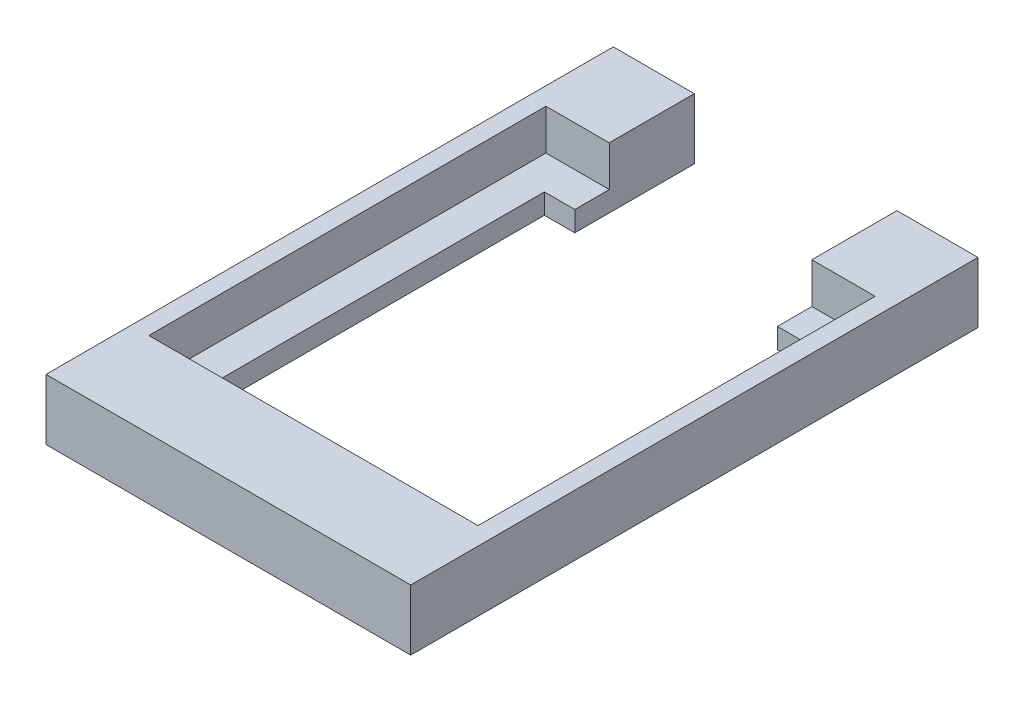
from build123d import *

# Parameters (mm, degrees)
SKETCH1_W           = 18
SKETCH1_H           = 28
BOSS_EXTRUDE1_DEPTH = 3
SKETCH1_3_W         = 13
SKETCH1_3_H         = 16.2
CUT_EXTRUDE1_DEPTH  = 17.911534525
SKETCH2_W           = 16.25
SKETCH2_H           = 19.6
CUT_EXTRUDE2_DEPTH  = 2
SKETCH4_W           = 10
SKETCH4_H           = 9
CUT_EXTRUDE3_DEPTH  = 17.911534525


with BuildPart() as part:
    # Sketch1 → Boss-Extrude1 (new body)
    with BuildSketch(Plane(origin=(0, 0, 0), x_dir=(1, 0, 0), z_dir=(0, 1, 0))):
        Rectangle(SKETCH1_W, SKETCH1_H)
    extrude(amount=BOSS_EXTRUDE1_DEPTH)

    # Sketch1<3> → Cut-Extrude1 (cut, through all)
    with BuildSketch(Plane(origin=(0, 0, 0), x_dir=(1, 0, 0), z_dir=(0, 1, 0))):
        Rectangle(SKETCH1_3_W, SKETCH1_3_H)
    extrude(amount=CUT_EXTRUDE1_DEPTH, mode=Mode.SUBTRACT)

    # Sketch2 → Cut-Extrude2 (cut)
    with BuildSketch(Plane(origin=(0, 3, 0), x_dir=(1, 0, 0), z_dir=(0, 1, 0))):
        Rectangle(SKETCH2_W, SKETCH2_H)
    extrude(amount=-CUT_EXTRUDE2_DEPTH, mode=Mode.SUBTRACT)

    # Sketch4 → Cut-Extrude3 (cut, through all)
    with BuildSketch(Plane(origin=(0, 3, 0), x_dir=(1, 0, 0), z_dir=(0, 1, 0))):
        with Locations((0, 9.8)):
            Rectangle(SKETCH4_W, SKETCH4_H)
    extrude(amount=-CUT_EXTRUDE3_DEPTH, mode=Mode.SUBTRACT)


solid = part.part
